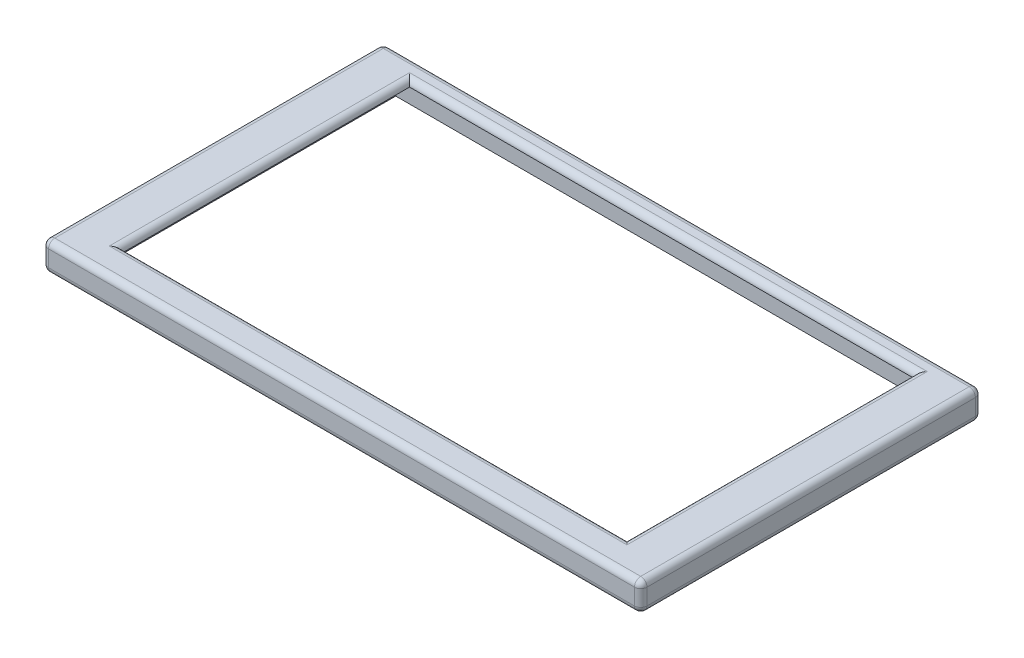
from build123d import *

# Parameters (mm, degrees)
CROQUIS1_W              = 191.3
CROQUIS1_H              = 109
CROQUIS1_W_2            = 161.5
CROQUIS1_H_2            = 92
SALIENTE_EXTRUIR1_DEPTH = 9.2
CROQUIS2_W              = 175.3
CROQUIS2_H              = 101
CROQUIS2_W_2            = 161.5
CROQUIS2_H_2            = 92
CORTAR_EXTRUIR1_DEPTH   = 7.2
CROQUIS3_W              = 4
CROQUIS3_H              = 53
CORTAR_EXTRUIR2_DEPTH   = 3
REDONDEO3_R             = 2


with BuildPart() as part:
    # Croquis1 → Saliente-Extruir1 (new body)
    with BuildSketch(Plane(origin=(0, 0, 0), x_dir=(1, 0, 0), z_dir=(0, 1, 0))):
        with Locations((95.65, 54.5)):
            Rectangle(CROQUIS1_W, CROQUIS1_H)
        with Locations((95.65, 56.5)):
            Rectangle(CROQUIS1_W_2, CROQUIS1_H_2, mode=Mode.SUBTRACT)
    extrude(amount=SALIENTE_EXTRUIR1_DEPTH)

    # Croquis2 → Cortar-Extruir1 (cut)
    with BuildSketch(Plane.XZ):
        with Locations((95.65, -54.5)):
            Rectangle(CROQUIS2_W, CROQUIS2_H)
        with Locations((95.65, -56.5)):
            Rectangle(CROQUIS2_W_2, CROQUIS2_H_2, mode=Mode.SUBTRACT)
    extrude(amount=-CORTAR_EXTRUIR1_DEPTH, mode=Mode.SUBTRACT)

    # Croquis3 → Cortar-Extruir2 (cut)
    with BuildSketch(Plane.XZ):
        with Locations((4, -54.5)):
            Rectangle(CROQUIS3_W, CROQUIS3_H)
    extrude(amount=-CORTAR_EXTRUIR2_DEPTH, mode=Mode.SUBTRACT)

    # Redondeo3
    redondeo3_edges = [part.edges().sort_by_distance(p)[0] for p in [
        (0, 0, -54.5),
        (0, 4.6, -109),
        (95.65, 0, -109),
        (191.3, 4.6, -109),
        (191.3, 0, -54.5),
        (0, 4.6, 0),
        (191.3, 4.6, 0),
        (95.65, 0, 0),
        (14.9, 9.2, -56.5),
        (95.65, 9.2, -10.5),
        (176.4, 9.2, -56.5),
        (95.65, 9.2, -102.5),
        (95.65, 9.2, -109),
        (191.3, 9.2, -54.5),
        (95.65, 9.2, 0),
        (0, 9.2, -54.5),
    ]]
    fillet(redondeo3_edges, radius=REDONDEO3_R - 0.0001)  # a hair under: the kernel refuses the full size


solid = part.part
